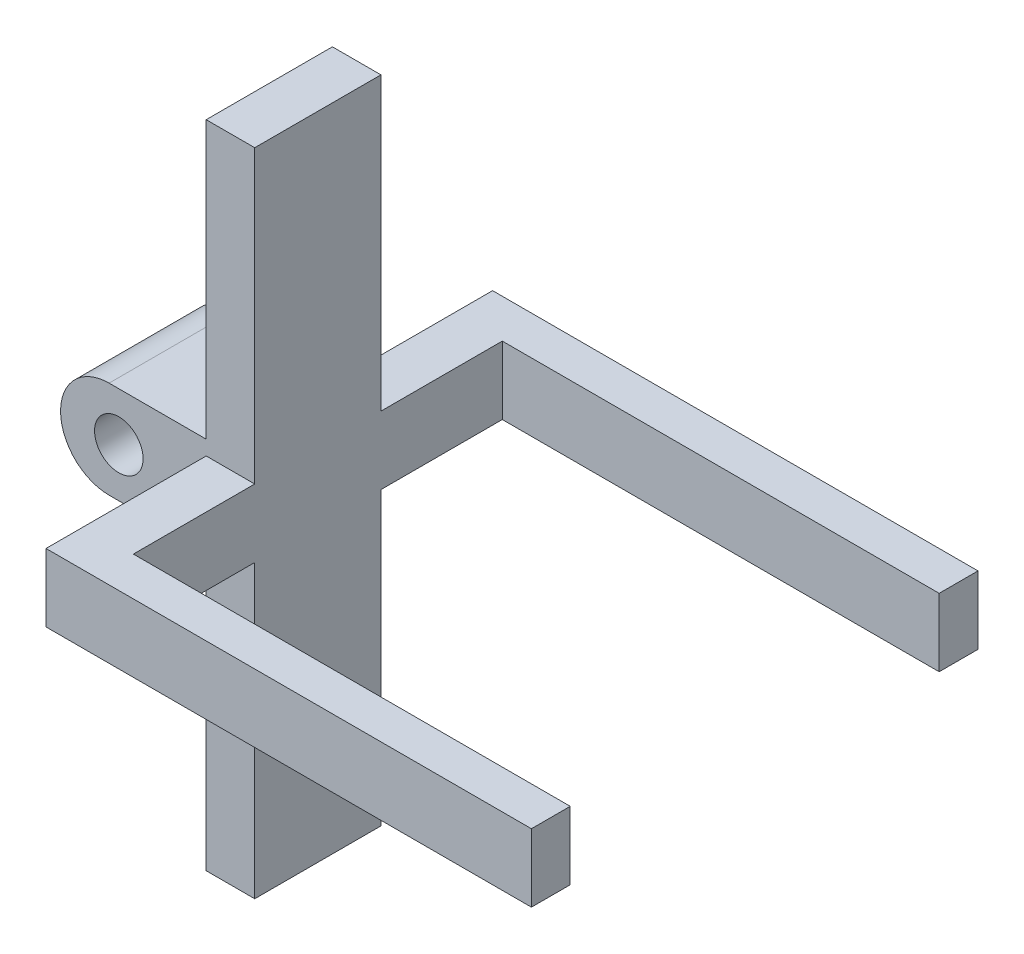
from build123d import *

# Parameters (mm, degrees)
SKETCH1_W           = 13
SKETCH1_H           = 10
BOSS_EXTRUDE1_DEPTH = 7.5
SKETCH2_R           = 2.5
CUT_EXTRUDE1_DEPTH  = 15
FILLET1_R           = 5
SKETCH3_W           = 46
SKETCH3_H           = 7
BOSS_EXTRUDE2_DEPTH = 5
SKETCH4_W           = 4
SKETCH4_H           = 7
BOSS_EXTRUDE3_DEPTH = 45
SKETCH5_W           = 5
SKETCH5_H           = 13
BOSS_EXTRUDE4_DEPTH = 30


with BuildPart() as part:
    # Sketch1 → Boss-Extrude1 (new, symmetric)
    with BuildSketch(Plane(origin=(0, 0, 0), x_dir=(0, 0, -1), z_dir=(1, 0, 0))):
        Rectangle(SKETCH1_W, SKETCH1_H)
    extrude(amount=BOSS_EXTRUDE1_DEPTH, both=True)

    # Sketch2 → Cut-Extrude1 (cut)
    with BuildSketch(Plane.XY.offset(6.5)):
        with Locations((-1.5, 0)):
            Circle(SKETCH2_R)
    extrude(amount=-CUT_EXTRUDE1_DEPTH, mode=Mode.SUBTRACT)

    # Fillet1
    fillet1_edges = [part.edges().sort_by_distance(p)[0] for p in [
        (-7.5, -5, 0),
        (-7.5, 5, 0),
    ]]
    fillet(fillet1_edges, radius=FILLET1_R - 0.0001)  # a hair under: the kernel refuses the full size

    # Sketch3 → Boss-Extrude2 (add)
    with BuildSketch(Plane(origin=(7.5, 0, 0), x_dir=(0, 0, -1), z_dir=(1, 0, 0))):
        Rectangle(SKETCH3_W, SKETCH3_H)
    extrude(amount=BOSS_EXTRUDE2_DEPTH)

    # Sketch4 → Boss-Extrude3 (add)
    with BuildSketch(Plane(origin=(12.5, 0, 0), x_dir=(0, 0, -1), z_dir=(1, 0, 0))):
        with Locations((-21, 0)):
            Rectangle(SKETCH4_W, SKETCH4_H)
        with Locations((21, 0)):
            Rectangle(SKETCH4_W, SKETCH4_H)
    extrude(amount=BOSS_EXTRUDE3_DEPTH)

    # Sketch5 → Boss-Extrude4 (add)
    with BuildSketch(Plane(origin=(0, 3.5, 0), x_dir=(1, 0, 0), z_dir=(0, 1, 0))):
        with Locations((10, 0)):
            Rectangle(SKETCH5_W, SKETCH5_H)
    boss_extrude4 = extrude(amount=BOSS_EXTRUDE4_DEPTH)

    # Mirror1: Boss-Extrude4 across plane
    add(boss_extrude4.mirror(Plane.ZX))


solid = part.part
